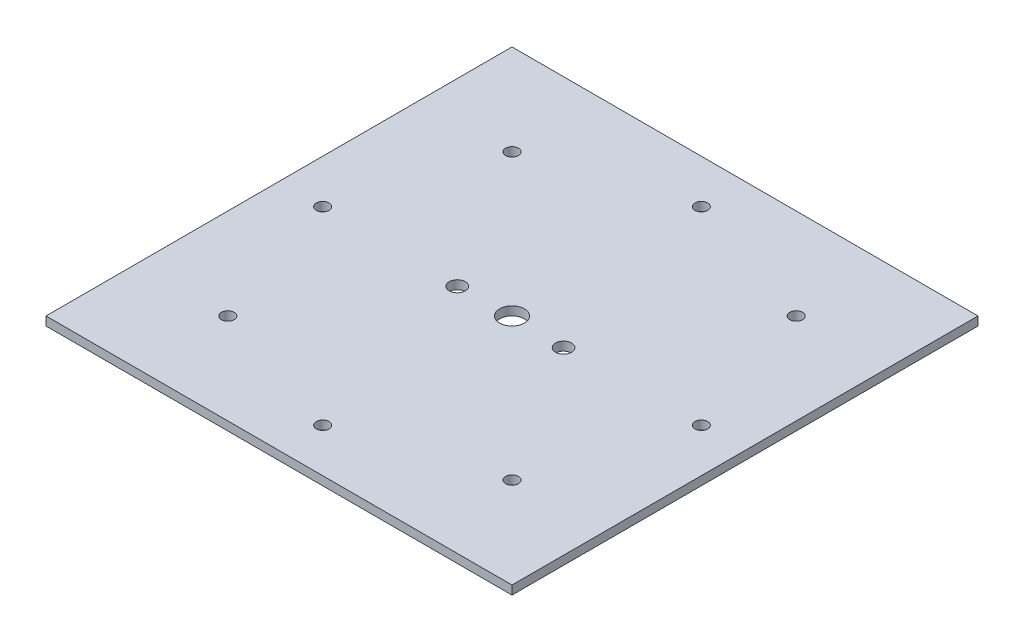
from build123d import *

# Parameters (mm, degrees)
SKETCH1_W           = 160
SKETCH1_H           = 160
SKETCH1_R           = 2.2
SKETCH1_R_2         = 4.25
SKETCH1_R_3         = 2.75
BOSS_EXTRUDE1_DEPTH = 3


with BuildPart() as part:
    # Sketch1 → Boss-Extrude1 (new body)
    with BuildSketch(Plane(origin=(0, 0, 0), x_dir=(1, 0, 0), z_dir=(0, 1, 0))):
        Rectangle(SKETCH1_W, SKETCH1_H)
        with Locations((48.790367902, 48.790367902)):
            Circle(SKETCH1_R, mode=Mode.SUBTRACT)
        with Locations((48.790367902, -48.790367902)):
            Circle(SKETCH1_R, mode=Mode.SUBTRACT)
        with Locations((-48.790367902, -48.790367902)):
            Circle(SKETCH1_R, mode=Mode.SUBTRACT)
        with Locations((-48.790367902, 48.790367902)):
            Circle(SKETCH1_R, mode=Mode.SUBTRACT)
        Circle(SKETCH1_R_2, mode=Mode.SUBTRACT)
        with Locations((18.272421355, -0.571625498)):
            Circle(SKETCH1_R_3, mode=Mode.SUBTRACT)
        with Locations((-18.227578645, -0.571625498)):
            Circle(SKETCH1_R_3, mode=Mode.SUBTRACT)
        with Locations((0, 65)):
            Circle(SKETCH1_R, mode=Mode.SUBTRACT)
        with Locations((65, 0)):
            Circle(SKETCH1_R, mode=Mode.SUBTRACT)
        with Locations((0, -65)):
            Circle(SKETCH1_R, mode=Mode.SUBTRACT)
        with Locations((-65, 0)):
            Circle(SKETCH1_R, mode=Mode.SUBTRACT)
    extrude(amount=BOSS_EXTRUDE1_DEPTH)


solid = part.part
